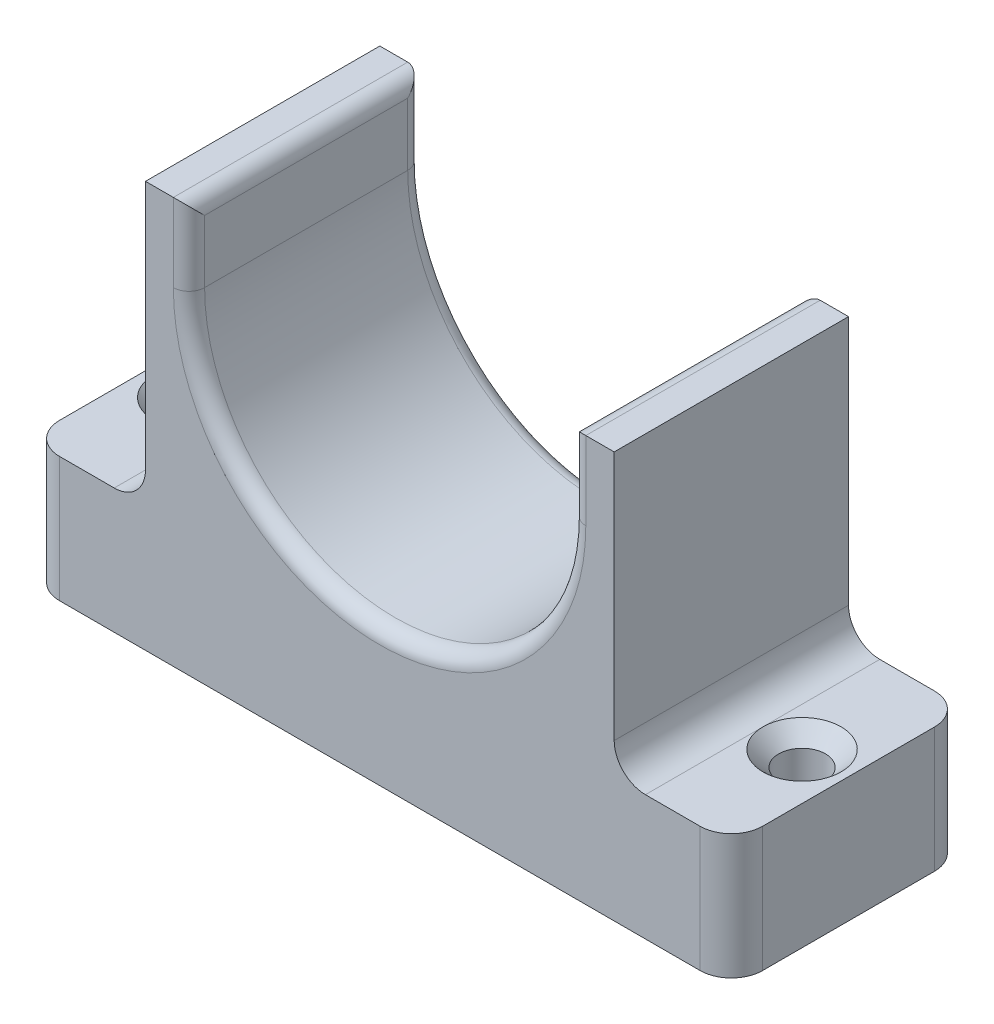
from build123d import *

# Parameters (mm, degrees)
SKETCH1_W           = 45
SKETCH1_H           = 15
BOSS_EXTRUDE1_DEPTH = 8
SKETCH2_W           = 30
SKETCH2_H           = 15
BOSS_EXTRUDE2_DEPTH = 18
FILLET1_R           = 2
SKETCH3_R           = 1.5
CUT_EXTRUDE1_DEPTH  = 20
CHAMFER1_SIZE       = 1
SKETCH13_R          = 12.2
CUT_EXTRUDE4_DEPTH  = 20
SKETCH14_W          = 24.4
SKETCH14_H          = 5
CUT_EXTRUDE5_DEPTH  = 20
FILLET4_R           = 1


with BuildPart() as part:
    # Sketch1 → Boss-Extrude1 (new body)
    with BuildSketch(Plane(origin=(0, 0, 0), x_dir=(1, 0, 0), z_dir=(0, 1, 0))):
        with Locations((22.5, 7.5)):
            Rectangle(SKETCH1_W, SKETCH1_H)
    extrude(amount=BOSS_EXTRUDE1_DEPTH)

    # Sketch2 → Boss-Extrude2 (add)
    with BuildSketch(Plane(origin=(0, 8, 0), x_dir=(1, 0, 0), z_dir=(0, 1, 0))):
        with Locations((22.5, 7.5)):
            Rectangle(SKETCH2_W, SKETCH2_H)
    extrude(amount=BOSS_EXTRUDE2_DEPTH)

    # Fillet1
    fillet1_edges = [part.edges().sort_by_distance(p)[0] for p in [
        (7.5, 8, -7.5),
        (37.5, 8, -7.5),
        (0, 4, 0),
        (0, 4, -15),
        (45, 4, -15),
        (45, 4, 0),
    ]]
    fillet(fillet1_edges, radius=FILLET1_R)

    # Sketch3 → Cut-Extrude1 (cut)
    with BuildSketch(Plane(origin=(0, 8, 0), x_dir=(1, 0, 0), z_dir=(0, 1, 0))):
        with Locations(Location((3, 7.524826623, 0), (0, 0, 270))):
            Circle(SKETCH3_R)
        with Locations(Location((42, 7.524826623, 0), (0, 0, 270))):
            Circle(SKETCH3_R)
    extrude(amount=-CUT_EXTRUDE1_DEPTH, mode=Mode.SUBTRACT)

    # Chamfer1
    chamfer1_edges = [part.edges().sort_by_distance(p)[0] for p in [
        (3, 8, -9.024826623),
        (42, 8, -9.024826623),
    ]]
    chamfer(chamfer1_edges, length=CHAMFER1_SIZE - 0.0001)  # a hair under: the kernel refuses the full size

    # Sketch13 → Cut-Extrude4 (cut)
    with BuildSketch(Plane.XY):
        with Locations((22.484903529, 21)):
            Circle(SKETCH13_R)
    extrude(amount=-CUT_EXTRUDE4_DEPTH, mode=Mode.SUBTRACT)

    # Sketch14 → Cut-Extrude5 (cut)
    with BuildSketch(Plane.XY):
        with Locations((22.484903529, 23.5)):
            Rectangle(SKETCH14_W, SKETCH14_H)
    extrude(amount=-CUT_EXTRUDE5_DEPTH, mode=Mode.SUBTRACT)

    # Fillet4
    fillet4_edges = [part.edges().sort_by_distance(p)[0] for p in [
        (22.484903529, 8.8, 0),
        (22.484903529, 8.8, -15),
        (10.284903529, 23.5, -15),
        (10.284903529, 26, -7.5),
        (34.684903529, 23.5, -15),
        (34.684903529, 26, -7.5),
        (10.284903529, 23.5, 0),
        (34.684903529, 23.5, 0),
    ]]
    fillet(fillet4_edges, radius=FILLET4_R)


solid = part.part
